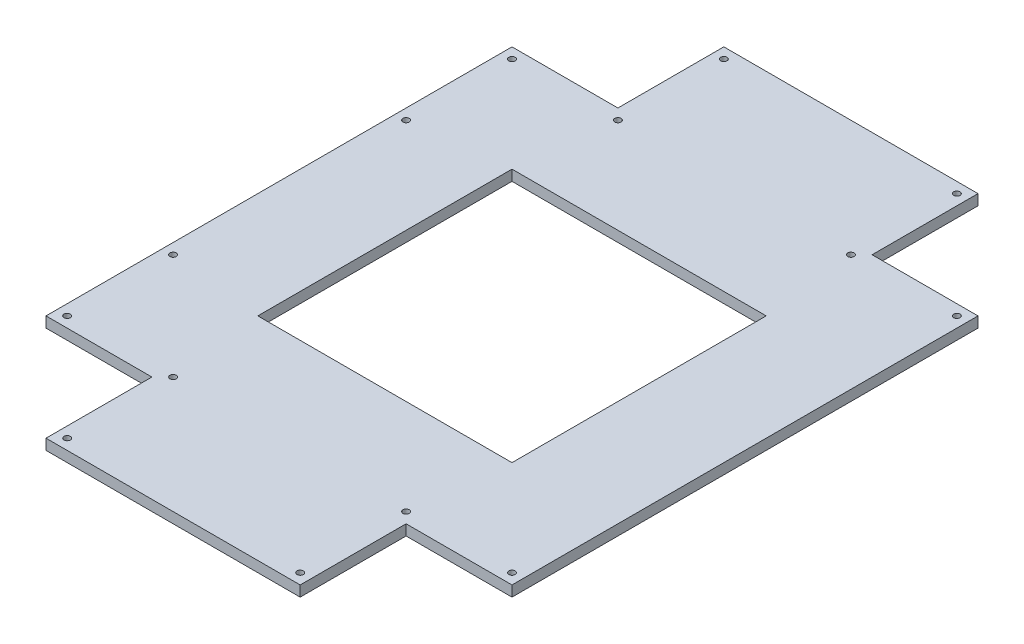
from build123d import *

# Parameters (mm, degrees)
ESQUISSE1_R        = 1.5
ESQUISSE1_W        = 120
ESQUISSE1_H        = 120
BOSS_EXTRU_1_DEPTH = 5


with BuildPart() as part:
    # Esquisse1 → Boss.-Extru.1 (new body)
    with BuildSketch(Plane(origin=(0, 0, 0), x_dir=(1, 0, 0), z_dir=(0, 1, 0))):
        Polygon((-60, 110), (-60, 160), (60, 160), (60, 110), (110, 110), (110, -110), (60, -110), (60, -160), (-60, -160), (-60, -110), (-110, -110), (-110, 0), (-110, 110), align=None)
        with Locations((-105, -105)):
            Circle(ESQUISSE1_R, mode=Mode.SUBTRACT)
        with Locations((-105, -55)):
            Circle(ESQUISSE1_R, mode=Mode.SUBTRACT)
        with Locations((-55, -105)):
            Circle(ESQUISSE1_R, mode=Mode.SUBTRACT)
        with Locations((-55, -155)):
            Circle(ESQUISSE1_R, mode=Mode.SUBTRACT)
        with Locations((-55, 155)):
            Circle(ESQUISSE1_R, mode=Mode.SUBTRACT)
        with Locations((-55, 105)):
            Circle(ESQUISSE1_R, mode=Mode.SUBTRACT)
        with Locations((-105, 105)):
            Circle(ESQUISSE1_R, mode=Mode.SUBTRACT)
        with Locations((-105, 55)):
            Circle(ESQUISSE1_R, mode=Mode.SUBTRACT)
        with Locations((55, -155)):
            Circle(ESQUISSE1_R, mode=Mode.SUBTRACT)
        with Locations((55, -105)):
            Circle(ESQUISSE1_R, mode=Mode.SUBTRACT)
        with Locations((105, -105)):
            Circle(ESQUISSE1_R, mode=Mode.SUBTRACT)
        with Locations((105, 105)):
            Circle(ESQUISSE1_R, mode=Mode.SUBTRACT)
        with Locations((55, 105)):
            Circle(ESQUISSE1_R, mode=Mode.SUBTRACT)
        with Locations((55, 155)):
            Circle(ESQUISSE1_R, mode=Mode.SUBTRACT)
        Rectangle(ESQUISSE1_W, ESQUISSE1_H, mode=Mode.SUBTRACT)
    extrude(amount=BOSS_EXTRU_1_DEPTH)


solid = part.part
